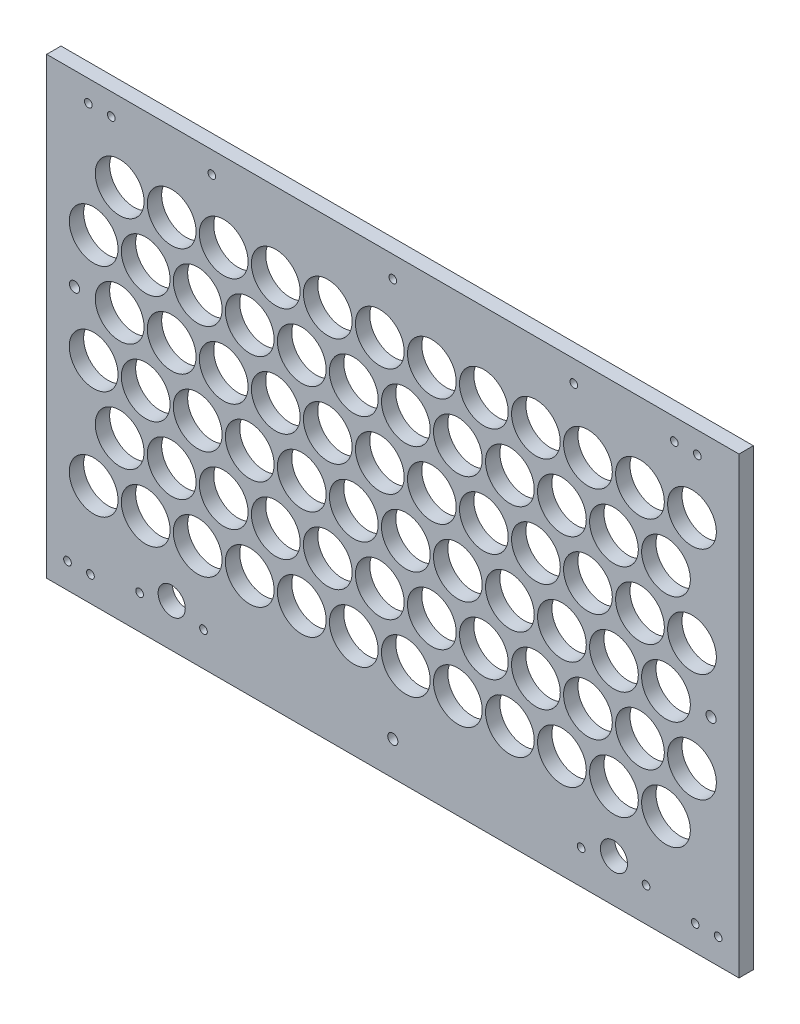
from build123d import *

# Parameters (mm, degrees)
SKETCH1_W                  = 306.05000007
SKETCH1_H                  = 197.4250001
BOSS_EXTRUDE1_DEPTH        = 6.35
CUT_EXTRUDE1_DEPTH         = 187.132543615
SKETCH4_R                  = 10.775
CUT_EXTRUDE2_DEPTH         = 187.132543615
LPATTERN1_COUNT            = 12
LPATTERN1_PITCH            = 23
LPATTERN2_COPY_1_DEPTH     = 187.132543615
LPATTERN2_COPY_2_DEPTH     = 187.132543615
LPATTERN2_COPY_3_DEPTH     = 187.132543615
LPATTERN2_COPY_4_DEPTH     = 187.132543615
LPATTERN2_COPY_5_DEPTH     = 187.132543615
LPATTERN2_COPY_6_DEPTH     = 187.132543615
LPATTERN2_COPY_7_DEPTH     = 187.132543615
LPATTERN2_COPY_8_DEPTH     = 187.132543615
LPATTERN2_COPY_9_DEPTH     = 187.132543615
LPATTERN2_COPY_10_DEPTH    = 187.132543615
LPATTERN2_COPY_11_DEPTH    = 187.132543615
LPATTERN2_COPY_12_DEPTH    = 187.132543615
LPATTERN2_COPY_13_DEPTH    = 187.132543615
LPATTERN2_COPY_14_DEPTH    = 187.132543615
LPATTERN2_COPY_15_DEPTH    = 187.132543615
LPATTERN2_COPY_16_DEPTH    = 187.132543615
LPATTERN2_COPY_17_DEPTH    = 187.132543615
LPATTERN2_COPY_18_DEPTH    = 187.132543615
LPATTERN2_COPY_19_DEPTH    = 187.132543615
LPATTERN2_COPY_20_DEPTH    = 187.132543615
LPATTERN2_COPY_21_DEPTH    = 187.132543615
LPATTERN2_COPY_22_DEPTH    = 187.132543615
LPATTERN2_COPY_23_SKETCH_R = 10.775
LPATTERN2_COPY_23_DEPTH    = 187.132543615
LPATTERN2_COPY_24_SKETCH_R = 10.775
LPATTERN2_COPY_24_DEPTH    = 187.132543615
LPATTERN2_COPY_25_SKETCH_R = 10.775
LPATTERN2_COPY_25_DEPTH    = 187.132543615
LPATTERN2_COPY_26_SKETCH_R = 10.775
LPATTERN2_COPY_26_DEPTH    = 187.132543615
LPATTERN2_COPY_27_SKETCH_R = 10.775
LPATTERN2_COPY_27_DEPTH    = 187.132543615
LPATTERN2_COPY_28_SKETCH_R = 10.775
LPATTERN2_COPY_28_DEPTH    = 187.132543615
LPATTERN2_COPY_29_SKETCH_R = 10.775
LPATTERN2_COPY_29_DEPTH    = 187.132543615
LPATTERN2_COPY_30_SKETCH_R = 10.775
LPATTERN2_COPY_30_DEPTH    = 187.132543615
LPATTERN2_COPY_31_SKETCH_R = 10.775
LPATTERN2_COPY_31_DEPTH    = 187.132543615
LPATTERN2_COPY_32_SKETCH_R = 10.775
LPATTERN2_COPY_32_DEPTH    = 187.132543615
LPATTERN2_COPY_33_SKETCH_R = 10.775
LPATTERN2_COPY_33_DEPTH    = 187.132543615
LPATTERN2_COPY_34_SKETCH_R = 10.775
LPATTERN2_COPY_34_DEPTH    = 187.132543615
LPATTERN2_COPY_35_SKETCH_R = 10.775
LPATTERN2_COPY_35_DEPTH    = 187.132543615
LPATTERN2_COPY_36_SKETCH_R = 10.775
LPATTERN2_COPY_36_DEPTH    = 187.132543615
LPATTERN2_COPY_37_SKETCH_R = 10.775
LPATTERN2_COPY_37_DEPTH    = 187.132543615
LPATTERN2_COPY_38_SKETCH_R = 10.775
LPATTERN2_COPY_38_DEPTH    = 187.132543615
LPATTERN2_COPY_39_SKETCH_R = 10.775
LPATTERN2_COPY_39_DEPTH    = 187.132543615
LPATTERN2_COPY_40_SKETCH_R = 10.775
LPATTERN2_COPY_40_DEPTH    = 187.132543615
LPATTERN2_COPY_41_SKETCH_R = 10.775
LPATTERN2_COPY_41_DEPTH    = 187.132543615
LPATTERN2_COPY_42_SKETCH_R = 10.775
LPATTERN2_COPY_42_DEPTH    = 187.132543615
LPATTERN2_COPY_43_SKETCH_R = 10.775
LPATTERN2_COPY_43_DEPTH    = 187.132543615
LPATTERN2_COPY_44_SKETCH_R = 10.775
LPATTERN2_COPY_44_DEPTH    = 187.132543615
LPATTERN2_COPY_45_DEPTH    = 187.132543615
LPATTERN2_COPY_46_DEPTH    = 187.132543615
LPATTERN2_COPY_47_SKETCH_R = 10.775
LPATTERN2_COPY_47_DEPTH    = 187.132543615
LPATTERN2_COPY_48_SKETCH_R = 10.775
LPATTERN2_COPY_48_DEPTH    = 187.132543615
SKETCH13_W                 = 306.05000007
SKETCH13_H                 = 6.35
BOSS_EXTRUDE2_DEPTH        = 3.175
SKETCH14_R                 = 6
CUT_EXTRUDE3_DEPTH         = 187.132543615
M3_CLEARANCE_HOLE1_D       = 3.4
SKETCH17_R                 = 2.25
CUT_EXTRUDE4_DEPTH         = 187.132543615


with BuildPart() as part:
    # Sketch1 → Boss-Extrude1 (new body)
    with BuildSketch(Plane.XY):
        with Locations((3.5e-08, -7.06250005)):
            Rectangle(SKETCH1_W, SKETCH1_H)
    extrude(amount=BOSS_EXTRUDE1_DEPTH)

    # Sketch3 → Cut-Extrude1 (cut, through all)
    with BuildSketch(Plane.XY.offset(6.35)):
        with BuildLine():
            ThreePointArc((-121.475, -60), (-132.24999993, -49.225), (-143.025, -59.999999859))
            ThreePointArc((-143.025, -59.999999859), (-139.869075617, -67.619075517), (-132.25, -70.775))
            ThreePointArc((-132.25, -70.775), (-124.630924433, -67.619075567), (-121.475, -60))
        make_face()
    cut_extrude1 = extrude(amount=-CUT_EXTRUDE1_DEPTH, mode=Mode.SUBTRACT)

    # Sketch4 → Cut-Extrude2 (cut, through all)
    with BuildSketch(Plane.XY.offset(6.35)):
        with Locations((-120.75, -36)):
            Circle(SKETCH4_R)
    cut_extrude2 = extrude(amount=-CUT_EXTRUDE2_DEPTH, mode=Mode.SUBTRACT)

    # LPattern1: Cut-Extrude1, Cut-Extrude2 ×12
    with Locations(*[(i * LPATTERN1_PITCH, 0, 0) for i in range(1, LPATTERN1_COUNT)]):
        add(cut_extrude1, mode=Mode.SUBTRACT)
        add(cut_extrude2, mode=Mode.SUBTRACT)

    # LPattern2 copy 1 sketch → LPattern2 copy 1 (cut, through all)
    with BuildSketch(Plane(origin=(23, 48, 6.35), x_dir=(1, 0, 0), z_dir=(0, 0, 1))):
        with BuildLine():
            ThreePointArc((-121.475, -60), (-132.24999993, -49.225), (-143.025, -59.999999859))
            ThreePointArc((-143.025, -59.999999859), (-139.869075617, -67.619075517), (-132.25, -70.775))
            ThreePointArc((-132.25, -70.775), (-124.630924433, -67.619075567), (-121.475, -60))
        make_face()
    extrude(amount=-LPATTERN2_COPY_1_DEPTH, mode=Mode.SUBTRACT)

    # LPattern2 copy 2 sketch → LPattern2 copy 2 (cut, through all)
    with BuildSketch(Plane(origin=(23, 96, 6.35), x_dir=(1, 0, 0), z_dir=(0, 0, 1))):
        with BuildLine():
            ThreePointArc((-121.475, -60), (-132.24999993, -49.225), (-143.025, -59.999999859))
            ThreePointArc((-143.025, -59.999999859), (-139.869075617, -67.619075517), (-132.25, -70.775))
            ThreePointArc((-132.25, -70.775), (-124.630924433, -67.619075567), (-121.475, -60))
        make_face()
    extrude(amount=-LPATTERN2_COPY_2_DEPTH, mode=Mode.SUBTRACT)

    # LPattern2 copy 3 sketch → LPattern2 copy 3 (cut, through all)
    with BuildSketch(Plane(origin=(46, 48, 6.35), x_dir=(1, 0, 0), z_dir=(0, 0, 1))):
        with BuildLine():
            ThreePointArc((-121.475, -60), (-132.24999993, -49.225), (-143.025, -59.999999859))
            ThreePointArc((-143.025, -59.999999859), (-139.869075617, -67.619075517), (-132.25, -70.775))
            ThreePointArc((-132.25, -70.775), (-124.630924433, -67.619075567), (-121.475, -60))
        make_face()
    extrude(amount=-LPATTERN2_COPY_3_DEPTH, mode=Mode.SUBTRACT)

    # LPattern2 copy 4 sketch → LPattern2 copy 4 (cut, through all)
    with BuildSketch(Plane(origin=(46, 96, 6.35), x_dir=(1, 0, 0), z_dir=(0, 0, 1))):
        with BuildLine():
            ThreePointArc((-121.475, -60), (-132.24999993, -49.225), (-143.025, -59.999999859))
            ThreePointArc((-143.025, -59.999999859), (-139.869075617, -67.619075517), (-132.25, -70.775))
            ThreePointArc((-132.25, -70.775), (-124.630924433, -67.619075567), (-121.475, -60))
        make_face()
    extrude(amount=-LPATTERN2_COPY_4_DEPTH, mode=Mode.SUBTRACT)

    # LPattern2 copy 5 sketch → LPattern2 copy 5 (cut, through all)
    with BuildSketch(Plane(origin=(69, 48, 6.35), x_dir=(1, 0, 0), z_dir=(0, 0, 1))):
        with BuildLine():
            ThreePointArc((-121.475, -60), (-132.24999993, -49.225), (-143.025, -59.999999859))
            ThreePointArc((-143.025, -59.999999859), (-139.869075617, -67.619075517), (-132.25, -70.775))
            ThreePointArc((-132.25, -70.775), (-124.630924433, -67.619075567), (-121.475, -60))
        make_face()
    extrude(amount=-LPATTERN2_COPY_5_DEPTH, mode=Mode.SUBTRACT)

    # LPattern2 copy 6 sketch → LPattern2 copy 6 (cut, through all)
    with BuildSketch(Plane(origin=(69, 96, 6.35), x_dir=(1, 0, 0), z_dir=(0, 0, 1))):
        with BuildLine():
            ThreePointArc((-121.475, -60), (-132.24999993, -49.225), (-143.025, -59.999999859))
            ThreePointArc((-143.025, -59.999999859), (-139.869075617, -67.619075517), (-132.25, -70.775))
            ThreePointArc((-132.25, -70.775), (-124.630924433, -67.619075567), (-121.475, -60))
        make_face()
    extrude(amount=-LPATTERN2_COPY_6_DEPTH, mode=Mode.SUBTRACT)

    # LPattern2 copy 7 sketch → LPattern2 copy 7 (cut, through all)
    with BuildSketch(Plane(origin=(92, 48, 6.35), x_dir=(1, 0, 0), z_dir=(0, 0, 1))):
        with BuildLine():
            ThreePointArc((-121.475, -60), (-132.24999993, -49.225), (-143.025, -59.999999859))
            ThreePointArc((-143.025, -59.999999859), (-139.869075617, -67.619075517), (-132.25, -70.775))
            ThreePointArc((-132.25, -70.775), (-124.630924433, -67.619075567), (-121.475, -60))
        make_face()
    extrude(amount=-LPATTERN2_COPY_7_DEPTH, mode=Mode.SUBTRACT)

    # LPattern2 copy 8 sketch → LPattern2 copy 8 (cut, through all)
    with BuildSketch(Plane(origin=(92, 96, 6.35), x_dir=(1, 0, 0), z_dir=(0, 0, 1))):
        with BuildLine():
            ThreePointArc((-121.475, -60), (-132.24999993, -49.225), (-143.025, -59.999999859))
            ThreePointArc((-143.025, -59.999999859), (-139.869075617, -67.619075517), (-132.25, -70.775))
            ThreePointArc((-132.25, -70.775), (-124.630924433, -67.619075567), (-121.475, -60))
        make_face()
    extrude(amount=-LPATTERN2_COPY_8_DEPTH, mode=Mode.SUBTRACT)

    # LPattern2 copy 9 sketch → LPattern2 copy 9 (cut, through all)
    with BuildSketch(Plane(origin=(115, 48, 6.35), x_dir=(1, 0, 0), z_dir=(0, 0, 1))):
        with BuildLine():
            ThreePointArc((-121.475, -60), (-132.24999993, -49.225), (-143.025, -59.999999859))
            ThreePointArc((-143.025, -59.999999859), (-139.869075617, -67.619075517), (-132.25, -70.775))
            ThreePointArc((-132.25, -70.775), (-124.630924433, -67.619075567), (-121.475, -60))
        make_face()
    extrude(amount=-LPATTERN2_COPY_9_DEPTH, mode=Mode.SUBTRACT)

    # LPattern2 copy 10 sketch → LPattern2 copy 10 (cut, through all)
    with BuildSketch(Plane(origin=(115, 96, 6.35), x_dir=(1, 0, 0), z_dir=(0, 0, 1))):
        with BuildLine():
            ThreePointArc((-121.475, -60), (-132.24999993, -49.225), (-143.025, -59.999999859))
            ThreePointArc((-143.025, -59.999999859), (-139.869075617, -67.619075517), (-132.25, -70.775))
            ThreePointArc((-132.25, -70.775), (-124.630924433, -67.619075567), (-121.475, -60))
        make_face()
    extrude(amount=-LPATTERN2_COPY_10_DEPTH, mode=Mode.SUBTRACT)

    # LPattern2 copy 11 sketch → LPattern2 copy 11 (cut, through all)
    with BuildSketch(Plane(origin=(138, 48, 6.35), x_dir=(1, 0, 0), z_dir=(0, 0, 1))):
        with BuildLine():
            ThreePointArc((-121.475, -60), (-132.24999993, -49.225), (-143.025, -59.999999859))
            ThreePointArc((-143.025, -59.999999859), (-139.869075617, -67.619075517), (-132.25, -70.775))
            ThreePointArc((-132.25, -70.775), (-124.630924433, -67.619075567), (-121.475, -60))
        make_face()
    extrude(amount=-LPATTERN2_COPY_11_DEPTH, mode=Mode.SUBTRACT)

    # LPattern2 copy 12 sketch → LPattern2 copy 12 (cut, through all)
    with BuildSketch(Plane(origin=(138, 96, 6.35), x_dir=(1, 0, 0), z_dir=(0, 0, 1))):
        with BuildLine():
            ThreePointArc((-121.475, -60), (-132.24999993, -49.225), (-143.025, -59.999999859))
            ThreePointArc((-143.025, -59.999999859), (-139.869075617, -67.619075517), (-132.25, -70.775))
            ThreePointArc((-132.25, -70.775), (-124.630924433, -67.619075567), (-121.475, -60))
        make_face()
    extrude(amount=-LPATTERN2_COPY_12_DEPTH, mode=Mode.SUBTRACT)

    # LPattern2 copy 13 sketch → LPattern2 copy 13 (cut, through all)
    with BuildSketch(Plane(origin=(161, 48, 6.35), x_dir=(1, 0, 0), z_dir=(0, 0, 1))):
        with BuildLine():
            ThreePointArc((-121.475, -60), (-132.24999993, -49.225), (-143.025, -59.999999859))
            ThreePointArc((-143.025, -59.999999859), (-139.869075617, -67.619075517), (-132.25, -70.775))
            ThreePointArc((-132.25, -70.775), (-124.630924433, -67.619075567), (-121.475, -60))
        make_face()
    extrude(amount=-LPATTERN2_COPY_13_DEPTH, mode=Mode.SUBTRACT)

    # LPattern2 copy 14 sketch → LPattern2 copy 14 (cut, through all)
    with BuildSketch(Plane(origin=(161, 96, 6.35), x_dir=(1, 0, 0), z_dir=(0, 0, 1))):
        with BuildLine():
            ThreePointArc((-121.475, -60), (-132.24999993, -49.225), (-143.025, -59.999999859))
            ThreePointArc((-143.025, -59.999999859), (-139.869075617, -67.619075517), (-132.25, -70.775))
            ThreePointArc((-132.25, -70.775), (-124.630924433, -67.619075567), (-121.475, -60))
        make_face()
    extrude(amount=-LPATTERN2_COPY_14_DEPTH, mode=Mode.SUBTRACT)

    # LPattern2 copy 15 sketch → LPattern2 copy 15 (cut, through all)
    with BuildSketch(Plane(origin=(184, 48, 6.35), x_dir=(1, 0, 0), z_dir=(0, 0, 1))):
        with BuildLine():
            ThreePointArc((-121.475, -60), (-132.24999993, -49.225), (-143.025, -59.999999859))
            ThreePointArc((-143.025, -59.999999859), (-139.869075617, -67.619075517), (-132.25, -70.775))
            ThreePointArc((-132.25, -70.775), (-124.630924433, -67.619075567), (-121.475, -60))
        make_face()
    extrude(amount=-LPATTERN2_COPY_15_DEPTH, mode=Mode.SUBTRACT)

    # LPattern2 copy 16 sketch → LPattern2 copy 16 (cut, through all)
    with BuildSketch(Plane(origin=(184, 96, 6.35), x_dir=(1, 0, 0), z_dir=(0, 0, 1))):
        with BuildLine():
            ThreePointArc((-121.475, -60), (-132.24999993, -49.225), (-143.025, -59.999999859))
            ThreePointArc((-143.025, -59.999999859), (-139.869075617, -67.619075517), (-132.25, -70.775))
            ThreePointArc((-132.25, -70.775), (-124.630924433, -67.619075567), (-121.475, -60))
        make_face()
    extrude(amount=-LPATTERN2_COPY_16_DEPTH, mode=Mode.SUBTRACT)

    # LPattern2 copy 17 sketch → LPattern2 copy 17 (cut, through all)
    with BuildSketch(Plane(origin=(207, 48, 6.35), x_dir=(1, 0, 0), z_dir=(0, 0, 1))):
        with BuildLine():
            ThreePointArc((-121.475, -60), (-132.24999993, -49.225), (-143.025, -59.999999859))
            ThreePointArc((-143.025, -59.999999859), (-139.869075617, -67.619075517), (-132.25, -70.775))
            ThreePointArc((-132.25, -70.775), (-124.630924433, -67.619075567), (-121.475, -60))
        make_face()
    extrude(amount=-LPATTERN2_COPY_17_DEPTH, mode=Mode.SUBTRACT)

    # LPattern2 copy 18 sketch → LPattern2 copy 18 (cut, through all)
    with BuildSketch(Plane(origin=(207, 96, 6.35), x_dir=(1, 0, 0), z_dir=(0, 0, 1))):
        with BuildLine():
            ThreePointArc((-121.475, -60), (-132.24999993, -49.225), (-143.025, -59.999999859))
            ThreePointArc((-143.025, -59.999999859), (-139.869075617, -67.619075517), (-132.25, -70.775))
            ThreePointArc((-132.25, -70.775), (-124.630924433, -67.619075567), (-121.475, -60))
        make_face()
    extrude(amount=-LPATTERN2_COPY_18_DEPTH, mode=Mode.SUBTRACT)

    # LPattern2 copy 19 sketch → LPattern2 copy 19 (cut, through all)
    with BuildSketch(Plane(origin=(230, 48, 6.35), x_dir=(1, 0, 0), z_dir=(0, 0, 1))):
        with BuildLine():
            ThreePointArc((-121.475, -60), (-132.24999993, -49.225), (-143.025, -59.999999859))
            ThreePointArc((-143.025, -59.999999859), (-139.869075617, -67.619075517), (-132.25, -70.775))
            ThreePointArc((-132.25, -70.775), (-124.630924433, -67.619075567), (-121.475, -60))
        make_face()
    extrude(amount=-LPATTERN2_COPY_19_DEPTH, mode=Mode.SUBTRACT)

    # LPattern2 copy 20 sketch → LPattern2 copy 20 (cut, through all)
    with BuildSketch(Plane(origin=(230, 96, 6.35), x_dir=(1, 0, 0), z_dir=(0, 0, 1))):
        with BuildLine():
            ThreePointArc((-121.475, -60), (-132.24999993, -49.225), (-143.025, -59.999999859))
            ThreePointArc((-143.025, -59.999999859), (-139.869075617, -67.619075517), (-132.25, -70.775))
            ThreePointArc((-132.25, -70.775), (-124.630924433, -67.619075567), (-121.475, -60))
        make_face()
    extrude(amount=-LPATTERN2_COPY_20_DEPTH, mode=Mode.SUBTRACT)

    # LPattern2 copy 21 sketch → LPattern2 copy 21 (cut, through all)
    with BuildSketch(Plane(origin=(253, 48, 6.35), x_dir=(1, 0, 0), z_dir=(0, 0, 1))):
        with BuildLine():
            ThreePointArc((-121.475, -60), (-132.24999993, -49.225), (-143.025, -59.999999859))
            ThreePointArc((-143.025, -59.999999859), (-139.869075617, -67.619075517), (-132.25, -70.775))
            ThreePointArc((-132.25, -70.775), (-124.630924433, -67.619075567), (-121.475, -60))
        make_face()
    extrude(amount=-LPATTERN2_COPY_21_DEPTH, mode=Mode.SUBTRACT)

    # LPattern2 copy 22 sketch → LPattern2 copy 22 (cut, through all)
    with BuildSketch(Plane(origin=(253, 96, 6.35), x_dir=(1, 0, 0), z_dir=(0, 0, 1))):
        with BuildLine():
            ThreePointArc((-121.475, -60), (-132.24999993, -49.225), (-143.025, -59.999999859))
            ThreePointArc((-143.025, -59.999999859), (-139.869075617, -67.619075517), (-132.25, -70.775))
            ThreePointArc((-132.25, -70.775), (-124.630924433, -67.619075567), (-121.475, -60))
        make_face()
    extrude(amount=-LPATTERN2_COPY_22_DEPTH, mode=Mode.SUBTRACT)

    # LPattern2 copy 23 sketch → LPattern2 copy 23 (cut, through all)
    with BuildSketch(Plane(origin=(23, 48, 6.35), x_dir=(1, 0, 0), z_dir=(0, 0, 1))):
        with Locations((-120.75, -36)):
            Circle(LPATTERN2_COPY_23_SKETCH_R)
    extrude(amount=-LPATTERN2_COPY_23_DEPTH, mode=Mode.SUBTRACT)

    # LPattern2 copy 24 sketch → LPattern2 copy 24 (cut, through all)
    with BuildSketch(Plane(origin=(23, 96, 6.35), x_dir=(1, 0, 0), z_dir=(0, 0, 1))):
        with Locations((-120.75, -36)):
            Circle(LPATTERN2_COPY_24_SKETCH_R)
    extrude(amount=-LPATTERN2_COPY_24_DEPTH, mode=Mode.SUBTRACT)

    # LPattern2 copy 25 sketch → LPattern2 copy 25 (cut, through all)
    with BuildSketch(Plane(origin=(46, 48, 6.35), x_dir=(1, 0, 0), z_dir=(0, 0, 1))):
        with Locations((-120.75, -36)):
            Circle(LPATTERN2_COPY_25_SKETCH_R)
    extrude(amount=-LPATTERN2_COPY_25_DEPTH, mode=Mode.SUBTRACT)

    # LPattern2 copy 26 sketch → LPattern2 copy 26 (cut, through all)
    with BuildSketch(Plane(origin=(46, 96, 6.35), x_dir=(1, 0, 0), z_dir=(0, 0, 1))):
        with Locations((-120.75, -36)):
            Circle(LPATTERN2_COPY_26_SKETCH_R)
    extrude(amount=-LPATTERN2_COPY_26_DEPTH, mode=Mode.SUBTRACT)

    # LPattern2 copy 27 sketch → LPattern2 copy 27 (cut, through all)
    with BuildSketch(Plane(origin=(69, 48, 6.35), x_dir=(1, 0, 0), z_dir=(0, 0, 1))):
        with Locations((-120.75, -36)):
            Circle(LPATTERN2_COPY_27_SKETCH_R)
    extrude(amount=-LPATTERN2_COPY_27_DEPTH, mode=Mode.SUBTRACT)

    # LPattern2 copy 28 sketch → LPattern2 copy 28 (cut, through all)
    with BuildSketch(Plane(origin=(69, 96, 6.35), x_dir=(1, 0, 0), z_dir=(0, 0, 1))):
        with Locations((-120.75, -36)):
            Circle(LPATTERN2_COPY_28_SKETCH_R)
    extrude(amount=-LPATTERN2_COPY_28_DEPTH, mode=Mode.SUBTRACT)

    # LPattern2 copy 29 sketch → LPattern2 copy 29 (cut, through all)
    with BuildSketch(Plane(origin=(92, 48, 6.35), x_dir=(1, 0, 0), z_dir=(0, 0, 1))):
        with Locations((-120.75, -36)):
            Circle(LPATTERN2_COPY_29_SKETCH_R)
    extrude(amount=-LPATTERN2_COPY_29_DEPTH, mode=Mode.SUBTRACT)

    # LPattern2 copy 30 sketch → LPattern2 copy 30 (cut, through all)
    with BuildSketch(Plane(origin=(92, 96, 6.35), x_dir=(1, 0, 0), z_dir=(0, 0, 1))):
        with Locations((-120.75, -36)):
            Circle(LPATTERN2_COPY_30_SKETCH_R)
    extrude(amount=-LPATTERN2_COPY_30_DEPTH, mode=Mode.SUBTRACT)

    # LPattern2 copy 31 sketch → LPattern2 copy 31 (cut, through all)
    with BuildSketch(Plane(origin=(115, 48, 6.35), x_dir=(1, 0, 0), z_dir=(0, 0, 1))):
        with Locations((-120.75, -36)):
            Circle(LPATTERN2_COPY_31_SKETCH_R)
    extrude(amount=-LPATTERN2_COPY_31_DEPTH, mode=Mode.SUBTRACT)

    # LPattern2 copy 32 sketch → LPattern2 copy 32 (cut, through all)
    with BuildSketch(Plane(origin=(115, 96, 6.35), x_dir=(1, 0, 0), z_dir=(0, 0, 1))):
        with Locations((-120.75, -36)):
            Circle(LPATTERN2_COPY_32_SKETCH_R)
    extrude(amount=-LPATTERN2_COPY_32_DEPTH, mode=Mode.SUBTRACT)

    # LPattern2 copy 33 sketch → LPattern2 copy 33 (cut, through all)
    with BuildSketch(Plane(origin=(138, 48, 6.35), x_dir=(1, 0, 0), z_dir=(0, 0, 1))):
        with Locations((-120.75, -36)):
            Circle(LPATTERN2_COPY_33_SKETCH_R)
    extrude(amount=-LPATTERN2_COPY_33_DEPTH, mode=Mode.SUBTRACT)

    # LPattern2 copy 34 sketch → LPattern2 copy 34 (cut, through all)
    with BuildSketch(Plane(origin=(138, 96, 6.35), x_dir=(1, 0, 0), z_dir=(0, 0, 1))):
        with Locations((-120.75, -36)):
            Circle(LPATTERN2_COPY_34_SKETCH_R)
    extrude(amount=-LPATTERN2_COPY_34_DEPTH, mode=Mode.SUBTRACT)

    # LPattern2 copy 35 sketch → LPattern2 copy 35 (cut, through all)
    with BuildSketch(Plane(origin=(161, 48, 6.35), x_dir=(1, 0, 0), z_dir=(0, 0, 1))):
        with Locations((-120.75, -36)):
            Circle(LPATTERN2_COPY_35_SKETCH_R)
    extrude(amount=-LPATTERN2_COPY_35_DEPTH, mode=Mode.SUBTRACT)

    # LPattern2 copy 36 sketch → LPattern2 copy 36 (cut, through all)
    with BuildSketch(Plane(origin=(161, 96, 6.35), x_dir=(1, 0, 0), z_dir=(0, 0, 1))):
        with Locations((-120.75, -36)):
            Circle(LPATTERN2_COPY_36_SKETCH_R)
    extrude(amount=-LPATTERN2_COPY_36_DEPTH, mode=Mode.SUBTRACT)

    # LPattern2 copy 37 sketch → LPattern2 copy 37 (cut, through all)
    with BuildSketch(Plane(origin=(184, 48, 6.35), x_dir=(1, 0, 0), z_dir=(0, 0, 1))):
        with Locations((-120.75, -36)):
            Circle(LPATTERN2_COPY_37_SKETCH_R)
    extrude(amount=-LPATTERN2_COPY_37_DEPTH, mode=Mode.SUBTRACT)

    # LPattern2 copy 38 sketch → LPattern2 copy 38 (cut, through all)
    with BuildSketch(Plane(origin=(184, 96, 6.35), x_dir=(1, 0, 0), z_dir=(0, 0, 1))):
        with Locations((-120.75, -36)):
            Circle(LPATTERN2_COPY_38_SKETCH_R)
    extrude(amount=-LPATTERN2_COPY_38_DEPTH, mode=Mode.SUBTRACT)

    # LPattern2 copy 39 sketch → LPattern2 copy 39 (cut, through all)
    with BuildSketch(Plane(origin=(207, 48, 6.35), x_dir=(1, 0, 0), z_dir=(0, 0, 1))):
        with Locations((-120.75, -36)):
            Circle(LPATTERN2_COPY_39_SKETCH_R)
    extrude(amount=-LPATTERN2_COPY_39_DEPTH, mode=Mode.SUBTRACT)

    # LPattern2 copy 40 sketch → LPattern2 copy 40 (cut, through all)
    with BuildSketch(Plane(origin=(207, 96, 6.35), x_dir=(1, 0, 0), z_dir=(0, 0, 1))):
        with Locations((-120.75, -36)):
            Circle(LPATTERN2_COPY_40_SKETCH_R)
    extrude(amount=-LPATTERN2_COPY_40_DEPTH, mode=Mode.SUBTRACT)

    # LPattern2 copy 41 sketch → LPattern2 copy 41 (cut, through all)
    with BuildSketch(Plane(origin=(230, 48, 6.35), x_dir=(1, 0, 0), z_dir=(0, 0, 1))):
        with Locations((-120.75, -36)):
            Circle(LPATTERN2_COPY_41_SKETCH_R)
    extrude(amount=-LPATTERN2_COPY_41_DEPTH, mode=Mode.SUBTRACT)

    # LPattern2 copy 42 sketch → LPattern2 copy 42 (cut, through all)
    with BuildSketch(Plane(origin=(230, 96, 6.35), x_dir=(1, 0, 0), z_dir=(0, 0, 1))):
        with Locations((-120.75, -36)):
            Circle(LPATTERN2_COPY_42_SKETCH_R)
    extrude(amount=-LPATTERN2_COPY_42_DEPTH, mode=Mode.SUBTRACT)

    # LPattern2 copy 43 sketch → LPattern2 copy 43 (cut, through all)
    with BuildSketch(Plane(origin=(253, 48, 6.35), x_dir=(1, 0, 0), z_dir=(0, 0, 1))):
        with Locations((-120.75, -36)):
            Circle(LPATTERN2_COPY_43_SKETCH_R)
    extrude(amount=-LPATTERN2_COPY_43_DEPTH, mode=Mode.SUBTRACT)

    # LPattern2 copy 44 sketch → LPattern2 copy 44 (cut, through all)
    with BuildSketch(Plane(origin=(253, 96, 6.35), x_dir=(1, 0, 0), z_dir=(0, 0, 1))):
        with Locations((-120.75, -36)):
            Circle(LPATTERN2_COPY_44_SKETCH_R)
    extrude(amount=-LPATTERN2_COPY_44_DEPTH, mode=Mode.SUBTRACT)

    # LPattern2 copy 45 sketch → LPattern2 copy 45 (cut, through all)
    with BuildSketch(Plane(origin=(0, 48, 6.35), x_dir=(1, 0, 0), z_dir=(0, 0, 1))):
        with BuildLine():
            ThreePointArc((-121.475, -60), (-132.24999993, -49.225), (-143.025, -59.999999859))
            ThreePointArc((-143.025, -59.999999859), (-139.869075617, -67.619075517), (-132.25, -70.775))
            ThreePointArc((-132.25, -70.775), (-124.630924433, -67.619075567), (-121.475, -60))
        make_face()
    extrude(amount=-LPATTERN2_COPY_45_DEPTH, mode=Mode.SUBTRACT)

    # LPattern2 copy 46 sketch → LPattern2 copy 46 (cut, through all)
    with BuildSketch(Plane(origin=(0, 96, 6.35), x_dir=(1, 0, 0), z_dir=(0, 0, 1))):
        with BuildLine():
            ThreePointArc((-121.475, -60), (-132.24999993, -49.225), (-143.025, -59.999999859))
            ThreePointArc((-143.025, -59.999999859), (-139.869075617, -67.619075517), (-132.25, -70.775))
            ThreePointArc((-132.25, -70.775), (-124.630924433, -67.619075567), (-121.475, -60))
        make_face()
    extrude(amount=-LPATTERN2_COPY_46_DEPTH, mode=Mode.SUBTRACT)

    # LPattern2 copy 47 sketch → LPattern2 copy 47 (cut, through all)
    with BuildSketch(Plane(origin=(0, 48, 6.35), x_dir=(1, 0, 0), z_dir=(0, 0, 1))):
        with Locations((-120.75, -36)):
            Circle(LPATTERN2_COPY_47_SKETCH_R)
    extrude(amount=-LPATTERN2_COPY_47_DEPTH, mode=Mode.SUBTRACT)

    # LPattern2 copy 48 sketch → LPattern2 copy 48 (cut, through all)
    with BuildSketch(Plane(origin=(0, 96, 6.35), x_dir=(1, 0, 0), z_dir=(0, 0, 1))):
        with Locations((-120.75, -36)):
            Circle(LPATTERN2_COPY_48_SKETCH_R)
    extrude(amount=-LPATTERN2_COPY_48_DEPTH, mode=Mode.SUBTRACT)

    # Sketch13 → Boss-Extrude2 (add)
    with BuildSketch(Plane(origin=(0, 91.65, 0), x_dir=(1, 0, 0), z_dir=(0, 1, 0))):
        with Locations((3.5e-08, -3.175)):
            Rectangle(SKETCH13_W, SKETCH13_H)
    extrude(amount=BOSS_EXTRUDE2_DEPTH)

    # Sketch14 → Cut-Extrude3 (cut, through all)
    with BuildSketch(Plane(origin=(0, 0, 0), x_dir=(-1, 0, 0), z_dir=(0, 0, -1))):
        with Locations((-97.75, -86.7750001)):
            Circle(SKETCH14_R)
    cut_extrude3 = extrude(amount=-CUT_EXTRUDE3_DEPTH, mode=Mode.SUBTRACT)

    # Mirror1: Cut-Extrude3 across plane
    add(cut_extrude3.mirror(Plane(origin=(0, 0, 0), x_dir=(0, 0, 1), z_dir=(1, 0, 0))), mode=Mode.SUBTRACT)

    # M3 Clearance Hole1 (through all)
    with Locations(Plane(origin=(0, 0, 0), x_dir=(-1, 0, 0), z_dir=(0, 0, -1))):
        with Locations((-111.94, -90.775), (-83.25, -90.775), (83.712, -90.775), (111.94, -90.775), (134.610000066, 85.3), (124.450000066, 85.3), (80, 85.3), (0, 85.3), (-80, 85.3), (-124.450000066, 85.3), (-134.610000066, 85.3), (143.817500066, -94.6000001), (133.657500066, -94.6000001), (-133.657500066, -94.6000001), (-143.817500066, -94.6000001)):
            Hole(M3_CLEARANCE_HOLE1_D / 2)

    # Sketch17 → Cut-Extrude4 (cut, through all)
    with BuildSketch(Plane(origin=(0, 0, 0), x_dir=(-1, 0, 0), z_dir=(0, 0, -1))):
        with Locations((0, -90.775)):
            Circle(SKETCH17_R)
        with Locations((140.687500033, 12)):
            Circle(SKETCH17_R)
        with Locations((-140.687500033, -12)):
            Circle(SKETCH17_R)
    extrude(amount=-CUT_EXTRUDE4_DEPTH, mode=Mode.SUBTRACT)


solid = part.part
